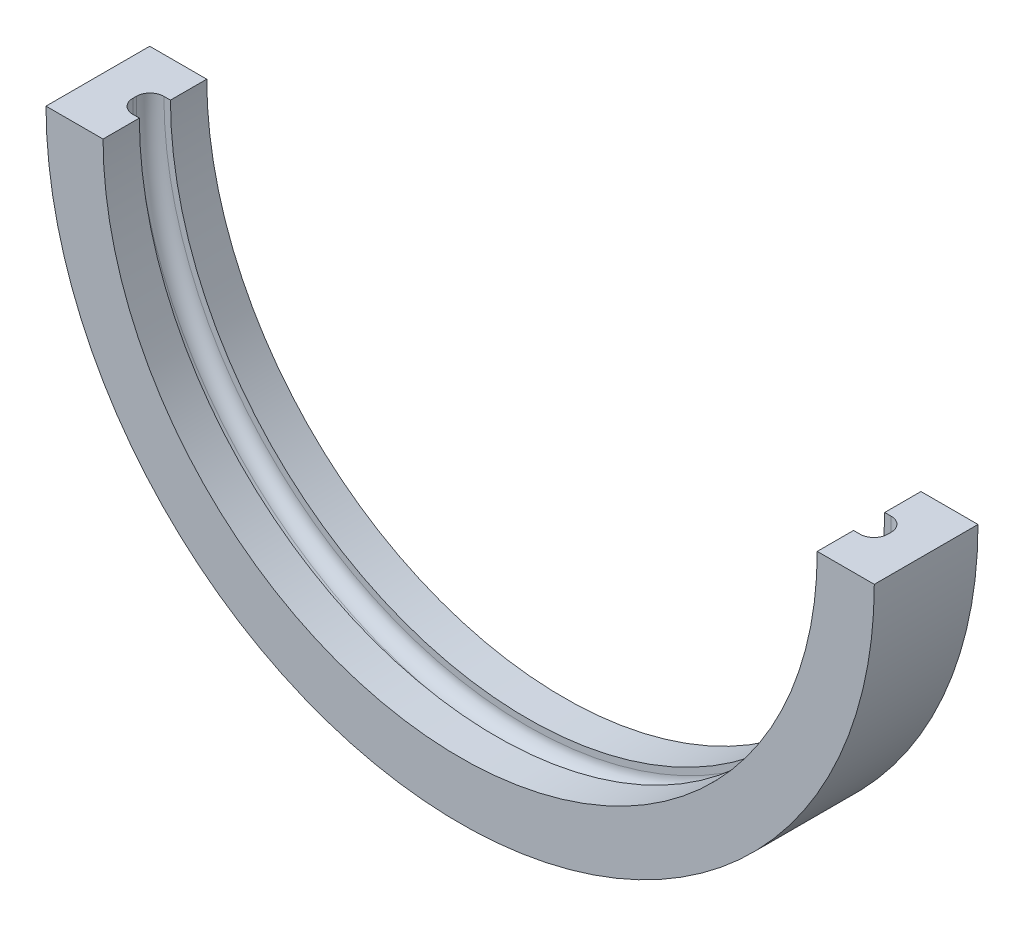
from build123d import *

# Parameters (mm, degrees)
BOSS_EXTRUDE1_DEPTH = 5.715
BOSS_EXTRUDE2_DEPTH = 6.6675
BOSS_EXTRUDE3_START = 6.6675
BOSS_EXTRUDE3_DEPTH = 6.6675
FILLET1_R           = 2.54
SKETCH5_R           = 1.524
CUT_EXTRUDE1_DEPTH  = 6.35


with BuildPart() as part:
    # Sketch1 → Boss-Extrude1 (new body)
    with BuildSketch(Plane.XY):
        with BuildLine():
            ThreePointArc((69.342, 76.073), (0, 6.731), (-69.342, 76.073))
            Line((-69.342, 76.073), (-76.073, 76.073))
            ThreePointArc((-76.073, 76.073), (0, 0), (76.073, 76.073))
            Line((76.073, 76.073), (69.342, 76.073))
        make_face()
    extrude(amount=BOSS_EXTRUDE1_DEPTH)

    # Sketch3 → Boss-Extrude2 (add)
    with BuildSketch(Plane.XY.offset(5.715)):
        with BuildLine():
            ThreePointArc((65.5955, 76.073), (0, 10.4775), (-65.5955, 76.073))
            Line((-65.5955, 76.073), (-76.073, 76.073))
            ThreePointArc((-76.073, 76.073), (0, 0), (76.073, 76.073))
            Line((76.073, 76.073), (65.5955, 76.073))
        make_face()
    extrude(amount=BOSS_EXTRUDE2_DEPTH)

    # Sketch4 → Boss-Extrude3 (add)
    with BuildSketch(Plane(origin=(0, 0, 0), x_dir=(-1, 0, 0), z_dir=(0, 0, -1)).offset(BOSS_EXTRUDE3_START)):
        with BuildLine():
            ThreePointArc((65.5955, 76.073), (0, 10.4775), (-65.5955, 76.073))
            Line((-65.5955, 76.073), (-76.073, 76.073))
            ThreePointArc((-76.073, 76.073), (0, 0), (76.073, 76.073))
            Line((76.073, 76.073), (65.5955, 76.073))
        make_face()
    extrude(amount=-BOSS_EXTRUDE3_DEPTH)

    # Fillet1
    fillet1_edges = [part.edges().sort_by_distance(p)[0] for p in [
        (0, 6.731, 5.715),
        (0, 6.731, 0),
    ]]
    fillet(fillet1_edges, radius=FILLET1_R)

    # Sketch5 → Cut-Extrude1 (cut)
    with BuildSketch(Plane(origin=(0, 0, 0), x_dir=(1, 0, 0), z_dir=(0, 1, 0))):
        with Locations((0, -2.8575)):
            Circle(SKETCH5_R)
    extrude(amount=CUT_EXTRUDE1_DEPTH, mode=Mode.SUBTRACT)


solid = part.part
